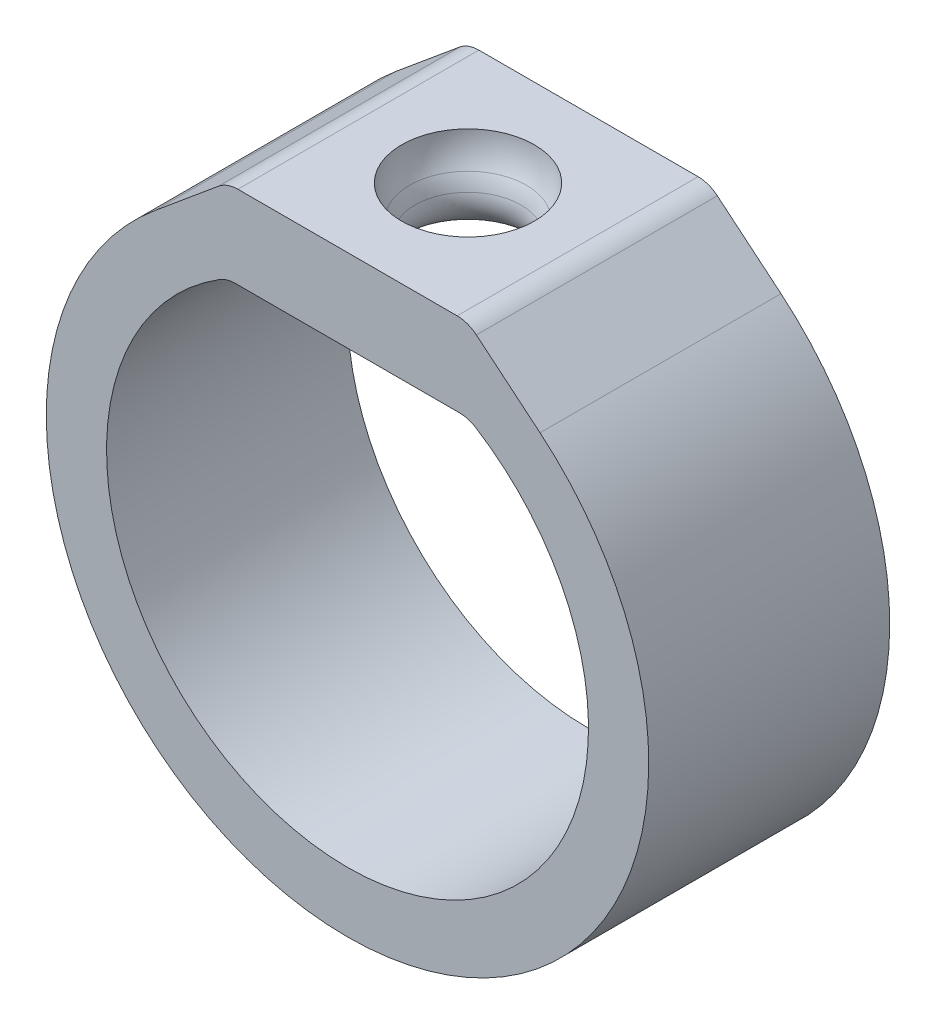
from build123d import *

# Parameters (mm, degrees)
BOSS_EXTRUDE1_DEPTH = 4
FILLET2_R           = 1
FILLET3_R           = 1


with BuildPart() as part:
    # Sketch1 → Boss-Extrude1 (new, symmetric)
    with BuildSketch(Plane.XY):
        with BuildLine():
            Line((-4, 9.67820323), (4, 9.67820323))
            Line((4, 9.67820323), (6.391333959, 7.690958992))
            ThreePointArc((6.391333959, 7.690958992), (0, -10), (-6.391333959, 7.690958992))
            Line((-6.391333959, 7.690958992), (-4, 9.67820323))
        make_face()
        with BuildLine():
            Line((-4, 6.92820323), (4, 6.92820323))
            ThreePointArc((4, 6.92820323), (0, -8), (-4, 6.92820323))
        make_face(mode=Mode.SUBTRACT)
    extrude(amount=BOSS_EXTRUDE1_DEPTH, both=True)

    # Sketch2 → Cut-Revolve1 (revolve, cut)
    with BuildSketch(Plane.XY):
        with BuildLine():
            Line((0, 6.72820323), (0, 11.87820323))
            ThreePointArc((0, 11.87820323), (1.886484437, 10.810093892), (1.941176471, 8.642909113))
            ThreePointArc((1.941176471, 8.642909113), (1.761207875, 8.175401262), (1.7, 7.67820323))
            Line((1.7, 7.67820323), (1.7, 6.72820323))
            Line((1.7, 6.72820323), (0, 6.72820323))
        make_face()
    revolve(axis=Axis((0, 6.72820323, 0), (0, 1, 0)), mode=Mode.SUBTRACT)

    # Fillet2
    # the kernel refuses this fillet: 1 mm, written as the material it takes off along each edge
    with BuildSketch(Plane(origin=(0, 6.92820323, 0), x_dir=(1, 0, 0), z_dir=(0, 0, -1))) as fillet2_piece_1:
        with BuildLine():
            CenterArc((2.730196097, -1), FILLET2_R, 90, 103.774146998)
            Line((1.758954285, -1.238095238), (1.661830104, -1.261904762))
            ThreePointArc((1.661830104, -1.261904762), (1.6, -0.75), (1.6, 0))
            Line((1.6, 0), (1.7, 0.1))
            Line((1.7, 0.1), (2.730196097, 0.1))
            Line((2.730196097, 0.1), (2.730196097, 0))
        make_face()
    revolve(axis=Axis((0, 6.92820323, 0), (0, -1, 0)), mode=Mode.SUBTRACT)

    # Fillet3
    fillet3_edges = [part.edges().sort_by_distance(p)[0] for p in [
        (-4, 6.92820323, 0),
        (4, 6.92820323, 0),
        (-4, 9.67820323, 0),
        (4, 9.67820323, 0),
    ]]
    fillet(fillet3_edges, radius=FILLET3_R)


solid = part.part
